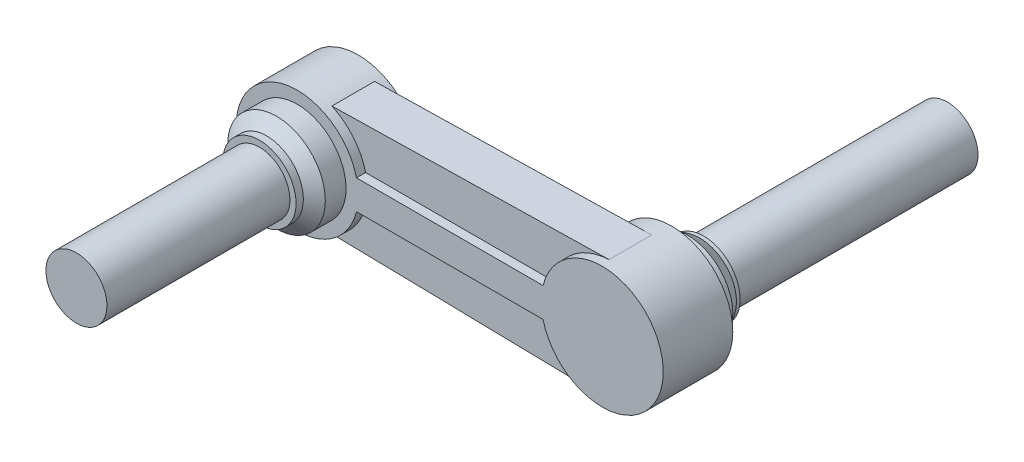
from build123d import *

# Parameters (mm, degrees)
SKETCH_1_R      = 25
EXTRUDE_1_DEPTH = 200
SKETCH_2_R      = 30
EXTRUDE_2_DEPTH = 3
SKETCH_3_R      = 37
EXTRUDE_3_DEPTH = 15
SKETCH_4_R      = 50
EXTRUDE_4_DEPTH = 65
CHAMFER_1_SIZE2 = 7
CHAMFER_1_SIZE  = 10
CHAMFER_2_SIZE2 = 8
CHAMFER_2_SIZE  = 13
EXTRUDE_5_DEPTH = 17.5
EXTRUDE_6_DEPTH = 25
SKETCH_7_R      = 40
EXTRUDE_7_DEPTH = 25
SKETCH_8_R      = 30
EXTRUDE_8_DEPTH = 6
CHAMFER_3_SIZE2 = 10
CHAMFER_3_SIZE  = 8
SKETCH_9_R      = 25
EXTRUDE_9_DEPTH = 150


with BuildPart() as part:
    # 草图1 → 凸台-拉伸1 (new body)
    with BuildSketch(Plane.XY):
        Circle(SKETCH_1_R)
    extrude(amount=-EXTRUDE_1_DEPTH)

    # 草图2 → 凸台-拉伸2 (add)
    with BuildSketch(Plane.XY):
        Circle(SKETCH_2_R)
    extrude(amount=EXTRUDE_2_DEPTH)

    # 草图3 → 凸台-拉伸3 (add)
    with BuildSketch(Plane.XY.offset(3)):
        Circle(SKETCH_3_R)
    extrude(amount=EXTRUDE_3_DEPTH)

    # 草图4 → 凸台-拉伸4 (add)
    with BuildSketch(Plane.XY.offset(18)):
        Circle(SKETCH_4_R)
    extrude(amount=EXTRUDE_4_DEPTH)

    # 倒角1
    chamfer_1_edges = [part.edges().sort_by_distance(p)[0] for p in [
        (-37, 0, 3),
    ]]
    chamfer_1_side = [part.faces().sort_by_distance(p)[0] for p in [
        (-37, 0, 3.14),
    ]]
    chamfer(chamfer_1_edges, length=CHAMFER_1_SIZE - 0.0001, length2=CHAMFER_1_SIZE2 - 0.0001, reference=chamfer_1_side[0])  # a hair under: the kernel refuses the full size

    # 倒角2
    chamfer_2_edges = [part.edges().sort_by_distance(p)[0] for p in [
        (-50, 0, 18),
    ]]
    chamfer_2_side = [part.faces().sort_by_distance(p)[0] for p in [
        (-49.84, 0, 18),
    ]]
    chamfer(chamfer_2_edges, length=CHAMFER_2_SIZE - 0.0001, length2=CHAMFER_2_SIZE2 - 0.0001, reference=chamfer_2_side[0])  # a hair under: the kernel refuses the full size

    # 草图5 → 凸台-拉伸5 (add, symmetric)
    with BuildSketch(Plane.XY.offset(58)):
        with BuildLine():
            Line((-1.99920032, 49.960015994), (-250, 45))
            ThreePointArc((-250, 45), (-295, 0), (-250, -45))
            Line((-250, -45), (-1.99920032, -49.960015994))
            ThreePointArc((-1.99920032, -49.960015994), (-50, 0), (-1.99920032, 49.960015994))
        make_face()
    extrude(amount=EXTRUDE_5_DEPTH, both=True)

    # 草图6 → 凸台-拉伸6 (add, symmetric)
    with BuildSketch(Plane.XY.offset(58)):
        with BuildLine():
            Line((-201.461355602, -12), (0, -12))
            Line((0, -12), (0, 12))
            Line((0, 12), (-201.461355602, 12))
            ThreePointArc((-201.461355602, 12), (-300, 0), (-201.461355602, -12))
        make_face()
    extrude(amount=EXTRUDE_6_DEPTH, both=True)

    # 草图7 → 凸台-拉伸7 (add)
    with BuildSketch(Plane.XY.offset(83)):
        with Locations((-250, 0)):
            Circle(SKETCH_7_R)
    extrude(amount=EXTRUDE_7_DEPTH)

    # 草图8 → 凸台-拉伸8 (add)
    with BuildSketch(Plane.XY.offset(108)):
        with Locations((-250, 0)):
            Circle(SKETCH_8_R)
    extrude(amount=EXTRUDE_8_DEPTH)

    # 倒角3
    chamfer_3_edges = [part.edges().sort_by_distance(p)[0] for p in [
        (-290, 0, 108),
    ]]
    chamfer_3_side = [part.faces().sort_by_distance(p)[0] for p in [
        (-290, 0, 107.84),
    ]]
    chamfer(chamfer_3_edges, length=CHAMFER_3_SIZE - 0.0001, length2=CHAMFER_3_SIZE2 - 0.0001, reference=chamfer_3_side[0])  # a hair under: the kernel refuses the full size

    # 草图9 → 凸台-拉伸9 (add)
    with BuildSketch(Plane.XY.offset(114)):
        with Locations((-250, 0)):
            Circle(SKETCH_9_R)
    extrude(amount=EXTRUDE_9_DEPTH)


solid = part.part
